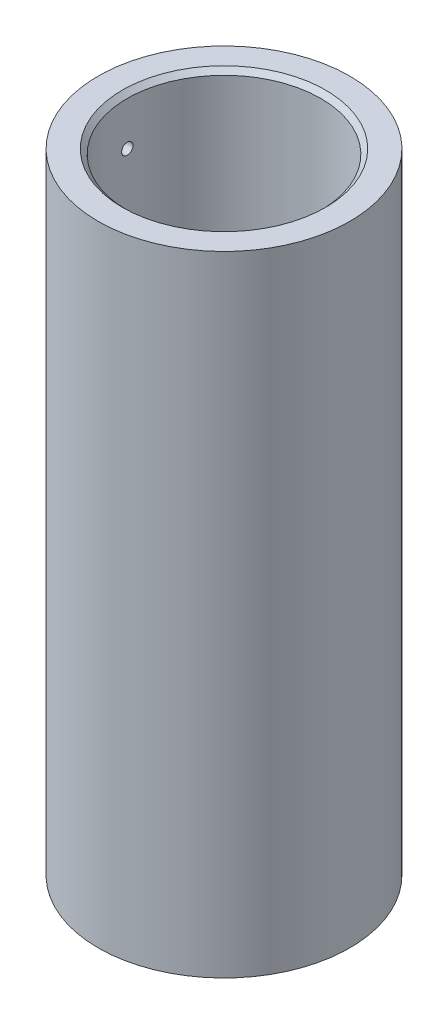
from build123d import *

# Parameters (mm, degrees)
SKETCH1_R           = 13
SKETCH1_R_2         = 10
BOSS_EXTRUDE1_DEPTH = 65
CHAMFER1_SIZE       = 0.5


with BuildPart() as part:
    # Sketch1 → Boss-Extrude1 (new body)
    with BuildSketch(Plane(origin=(0, 0, 0), x_dir=(1, 0, 0), z_dir=(0, 1, 0))):
        Circle(SKETCH1_R)
        Circle(SKETCH1_R_2, mode=Mode.SUBTRACT)
    extrude(amount=BOSS_EXTRUDE1_DEPTH)

    # Chamfer1
    chamfer1_edges = [part.edges().sort_by_distance(p)[0] for p in [
        (-10, 0, 0),
        (-10, 65, 0),
    ]]
    chamfer(chamfer1_edges, length=CHAMFER1_SIZE)

    # Sketch5 → Cut-Revolve4 (revolve, cut)
    with BuildSketch(Plane.XY):
        Polygon((-13, 60.948970234), (-12, 60.585), (-9, 60.585), (-9, 60), (-13, 60), align=None)
    revolve(axis=Axis((-13, 60, 0), (1, 0, 0)), mode=Mode.SUBTRACT)


solid = part.part
